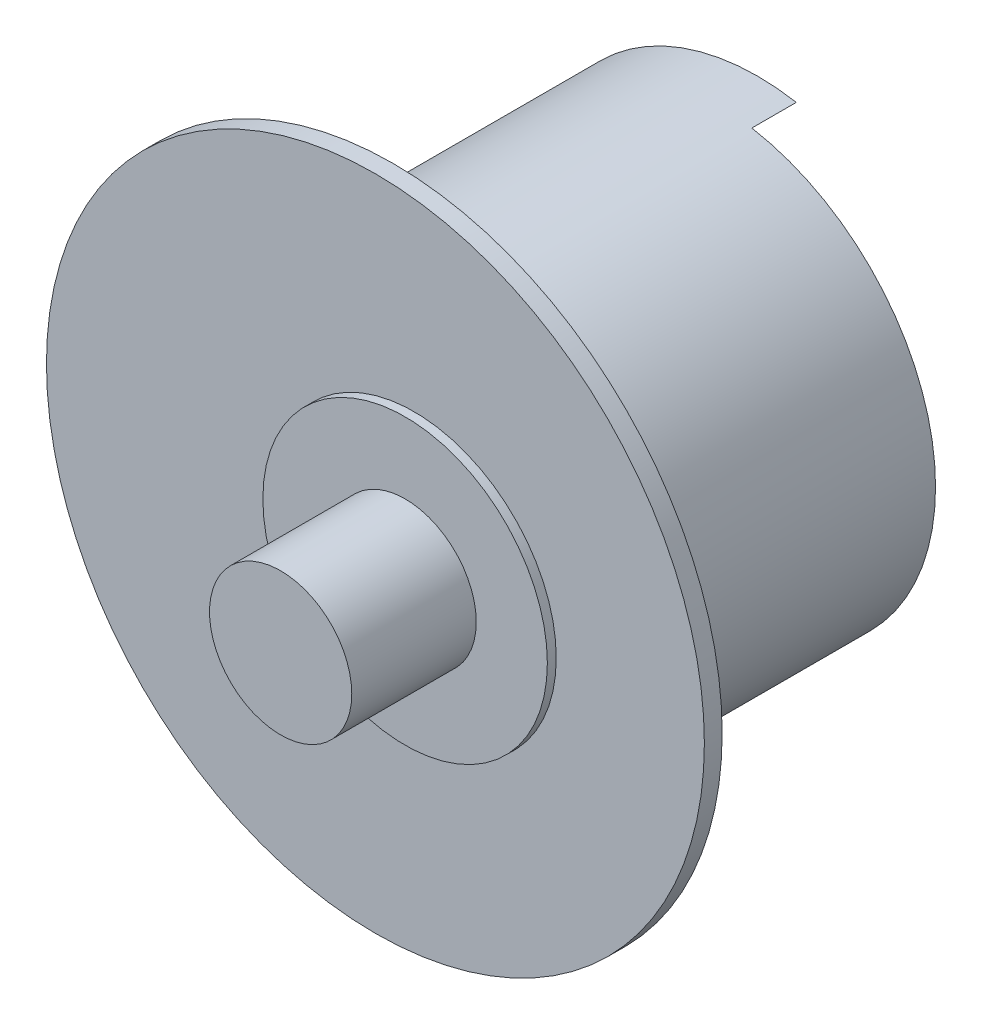
from build123d import *

# Parameters (mm, degrees)
SKETCH1_R           = 12.5
BOSS_EXTRUDE1_DEPTH = 13
SKETCH6_R           = 12.5
BOSS_EXTRUDE7_DEPTH = 5
SKETCH3_R           = 18.5
BOSS_EXTRUDE3_DEPTH = 1
SKETCH4_R           = 8
BOSS_EXTRUDE5_DEPTH = 0.5
SKETCH5_R           = 4
BOSS_EXTRUDE6_DEPTH = 7
BOSS_EXTRUDE8_START = 2.5
BOSS_EXTRUDE8_DEPTH = 2.5


with BuildPart() as part:
    # Sketch1 → Boss-Extrude1 (new body)
    with BuildSketch(Plane.XY):
        with Locations((-2.17, 0)):
            Circle(SKETCH1_R)
        Polygon((-4, 0), (-2, 3.464101615), (2, 3.464101615), (4, 0), (2, -3.464101615), (-2, -3.464101615), align=None, mode=Mode.SUBTRACT)
    extrude(amount=BOSS_EXTRUDE1_DEPTH)

    # Sketch6 → Boss-Extrude7 (add)
    with BuildSketch(Plane.XY.offset(13)):
        with Locations((-2.17, 0)):
            Circle(SKETCH6_R)
    extrude(amount=BOSS_EXTRUDE7_DEPTH)

    # Sketch3 → Boss-Extrude3 (add)
    with BuildSketch(Plane(origin=(0, 0, 18), x_dir=(-1, 0, 0), z_dir=(0, 0, -1))):
        with Locations((2.17, 0)):
            Circle(SKETCH3_R)
    extrude(amount=-BOSS_EXTRUDE3_DEPTH)

    # Sketch4 → Boss-Extrude5 (add)
    with BuildSketch(Plane.XY.offset(19)):
        Circle(SKETCH4_R)
    extrude(amount=BOSS_EXTRUDE5_DEPTH)

    # Sketch5 → Boss-Extrude6 (add)
    with BuildSketch(Plane.XY.offset(19.5)):
        Circle(SKETCH5_R)
    extrude(amount=BOSS_EXTRUDE6_DEPTH)

    # Sketch7 → Boss-Extrude8 (add)
    with BuildSketch(Plane(origin=(0, 0, 0), x_dir=(-1, 0, 0), z_dir=(0, 0, -1)).offset(BOSS_EXTRUDE8_START)):
        with BuildLine():
            ThreePointArc((0, -12.310203085), (10.20507934, -9.575359001), (14.67, 0))
            ThreePointArc((14.67, 0), (10.20507934, 9.575359001), (0, 12.310203085))
            ThreePointArc((0, 12.310203085), (10.33, 0), (0, -12.310203085))
        make_face()
    extrude(amount=-BOSS_EXTRUDE8_DEPTH)


solid = part.part
